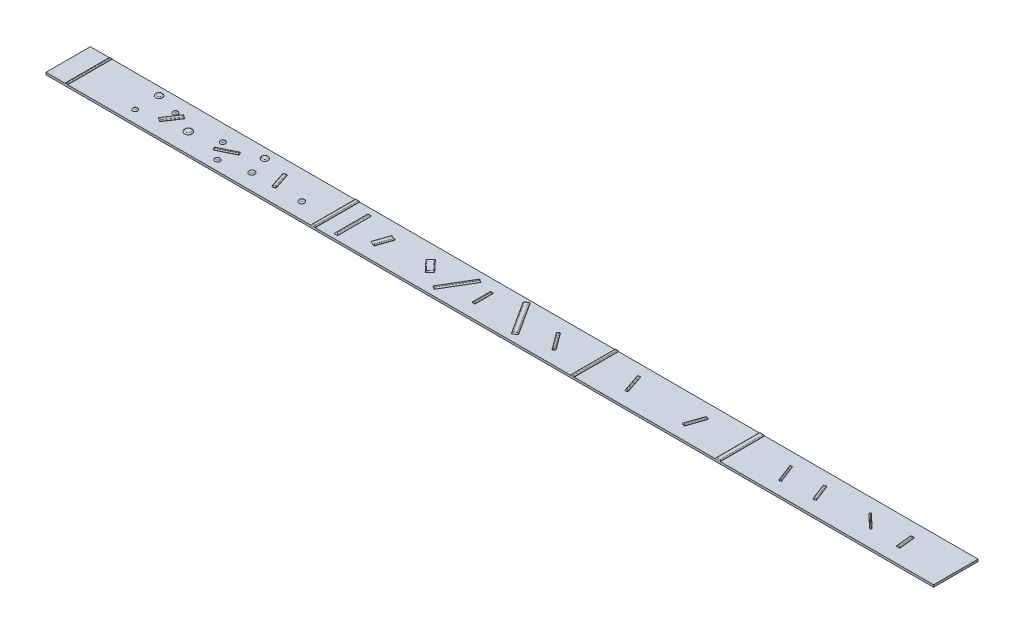
from build123d import *

# Parameters (mm, degrees)
CROQUIS1_W              = 40000
CROQUIS1_H              = 2000
SALIENTE_EXTRUIR1_DEPTH = 100
CROQUIS3_R              = 152.108396345
CROQUIS3_R_2            = 170.388191929
CROQUIS3_R_3            = 149.587088083
CROQUIS3_R_4            = 124.096570201
CROQUIS3_R_5            = 107.768052056
CROQUIS3_R_6            = 114.555528348
CROQUIS3_R_7            = 113.895307506
CROQUIS3_R_8            = 109.694025052
CROQUIS3_R_9            = 130.358105543
SALIENTE_EXTRUIR2_DEPTH = 50
REDONDEO1_R             = 50
CROQUIS4_W              = 143.310912253
CROQUIS4_H              = 1519.095669882
SALIENTE_EXTRUIR3_DEPTH = 50
REDONDEO2_R             = 50
CROQUIS2_W              = 100
CROQUIS2_H              = 2000
CROQUIS2_W_2            = 180.877173655
CROQUIS2_W_3            = 143.896077798
CROQUIS2_W_4            = 219.636697941
CROQUIS2_W_5            = 114.282510319
CROQUIS2_H_2            = 822.396549459
SALIENTE_EXTRUIR4_DEPTH = 50
REDONDEO3_R             = 40


with BuildPart() as part:
    # Croquis1 → Saliente-Extruir1 (new body)
    with BuildSketch(Plane(origin=(0, 0, 0), x_dir=(1, 0, 0), z_dir=(0, 1, 0))):
        Rectangle(CROQUIS1_W, CROQUIS1_H)
    extrude(amount=SALIENTE_EXTRUIR1_DEPTH)

    # Croquis3 → Saliente-Extruir2 (add)
    with BuildSketch(Plane(origin=(0, 100, 0), x_dir=(1, 0, 0), z_dir=(0, 1, 0))):
        with Locations(Location((-16527.746588557, 627.690739919, 0), (0, 0, 270))):
            Circle(CROQUIS3_R)
        with Locations(Location((-14473.623512929, -112.748973388, 0), (0, 0, 270))):
            Circle(CROQUIS3_R_2)
        with Locations(Location((-11694.98415869, 556.035283793, 0), (0, 0, 270))):
            Circle(CROQUIS3_R_3)
        with Locations(Location((-9187.043194261, -283.137165317, 0), (0, 0, 270))):
            Circle(CROQUIS3_R_4)
        with Locations(Location((-16527.746588557, -453.459030591, 0), (0, 0, 270))):
            Circle(CROQUIS3_R_5)
        with Locations(Location((-12713.049223627, -561.227082647, 0), (0, 0, 270))):
            Circle(CROQUIS3_R_6)
        with Locations(Location((-13274.85489442, 248.7980579, 0), (0, 0, 270))):
            Circle(CROQUIS3_R_7)
        with Locations(Location((-15488.636763855, 322.367848123, 0), (0, 0, 270))):
            Circle(CROQUIS3_R_8)
        with Locations(Location((-11435.610138848, -283.137165317, 0), (0, 0, 270))):
            Circle(CROQUIS3_R_9)
    extrude(amount=SALIENTE_EXTRUIR2_DEPTH)

    # Redondeo1
    redondeo1_edges = [part.edges().sort_by_distance(p)[0] for p in [
        (-16527.746588557, 150, -779.799136264),
        (-14473.623512929, 150, -57.639218541),
        (-11694.98415869, 150, -705.622371876),
        (-9187.043194261, 150, 159.040595117),
        (-16527.746588557, 150, 345.690978535),
        (-12713.049223627, 150, 446.6715543),
        (-13274.85489442, 150, -362.693365406),
        (-15488.636763855, 150, -432.061873176),
        (-11435.610138848, 150, 152.779059775),
    ]]
    fillet(redondeo1_edges, radius=REDONDEO1_R - 0.0001)  # a hair under: the kernel refuses the full size

    # Croquis4 → Saliente-Extruir3 (add)
    with BuildSketch(Plane(origin=(0, 100, 0), x_dir=(1, 0, 0), z_dir=(0, 1, 0))):
        Polygon((-2782.839723038, -722.088234936), (-1999.406736055, 596.372157792), (-2134.691169398, 676.758560213), (-2918.124156381, -641.701832515), align=None)
        with Locations((-7125.160364307, -48.526947347)):
            Rectangle(CROQUIS4_W, CROQUIS4_H)
        Polygon((-270.121728202, 768.345252496), (694.838414302, -722.088234936), (888.905049881, -596.442528568), (-76.055092623, 893.990958864), align=None)
    extrude(amount=SALIENTE_EXTRUIR3_DEPTH)

    # Redondeo2
    redondeo2_edges = [part.edges().sort_by_distance(p)[0] for p in [
        (406.424978629, 150, -148.774215148),
        (791.871732092, 150, 659.265381752),
        (212.35834305, 150, -23.12850878),
        (-173.088410412, 150, -831.16810568),
        (-2526.407662889, 150, -17.528363849),
        (-2067.048952726, 150, -636.565359002),
        (-2391.123229547, 150, 62.858038572),
        (-2850.48193971, 150, 681.895033726),
        (-7125.160364306, 150, -711.020887594),
        (-7053.50490818, 150, 48.526947347),
        (-7125.160364306, 150, 808.074782288),
        (-7196.815820433, 150, 48.526947347),
    ]]
    fillet(redondeo2_edges, radius=REDONDEO2_R - 0.0001)  # a hair under: the kernel refuses the full size

    # Croquis2 → Saliente-Extruir4 (add)
    with BuildSketch(Plane(origin=(0, 100, 0), x_dir=(1, 0, 0), z_dir=(0, 1, 0))):
        with Locations((-19073.938175418, 0)):
            Rectangle(CROQUIS2_W, CROQUIS2_H)
        Polygon((-13200.612317569, -266.885071318), (-12417.230490215, 116.812150244), (-12473.618644207, 231.937964643), (-13257.000471561, -151.759256918), align=None)
        with Locations((-7959.216706845, 0)):
            Rectangle(CROQUIS2_W_2, CROQUIS2_H)
        Polygon((-4111.603217322, 231.937964643), (-3644.070039938, -266.885071318), (-3424.528990466, -61.115255118), (-3892.06216785, 437.707780843), align=None)
        with Locations((3727.269343407, 0)):
            Rectangle(CROQUIS2_W_3, CROQUIS2_H)
        with Locations((10276.927676429, 0)):
            Rectangle(CROQUIS2_W_4, CROQUIS2_H)
        Polygon((-15509.781831253, -367.978873057), (-15663.991448235, -266.885071318), (-15215.863399016, 416.694472035), (-15061.653782035, 315.600670296), align=None)
        Polygon((-10543.603216778, 416.694472035), (-10693.38224704, 366.147571165), (-10439.279476977, -386.801983253), (-10289.500446715, -336.255082384), align=None)
        Polygon((-5806.725294453, 391.4210216), (-5586.272921152, 315.600670296), (-5827.123996956, -384.688768616), (-6047.576370257, -308.868417311), align=None)
        with Locations((-1346.297728627, 26.509506114)):
            Rectangle(CROQUIS2_W_5, CROQUIS2_H_2)
        Polygon((1682.872272567, 315.600670296), (1785.319109245, 391.4210216), (2334.724446597, -350.923716948), (2232.277609919, -426.744068252), align=None)
        Polygon((5296.79592742, 492.307284829), (5192.502339411, 457.110651194), (5476.323946606, -383.900852219), (5580.617534615, -348.704218584), align=None)
        Polygon((8191.434152086, -426.744068252), (8065.784994933, -383.900852219), (8340.18710195, 420.856508686), (8465.836259103, 378.013292653), align=None)
        Polygon((12135.083446709, 378.013292653), (12448.464036315, -426.744068252), (12535.667441119, -392.786187603), (12222.286851513, 411.971173302), align=None)
        Polygon((13771.056978067, 411.971173302), (14066.500580478, -346.724233045), (13948.056905032, -392.847388482), (13652.613302622, 365.848017865), align=None)
        Polygon((15767.342492683, 315.600670296), (16382.625284736, -266.885071318), (16437.643938463, -208.768574275), (15822.361146409, 373.717167338), align=None)
        Polygon((17597.961497728, 373.717167338), (17672.127380606, -346.724233045), (17811.07923868, -332.419825738), (17736.913355802, 388.021574645), align=None)
    extrude(amount=SALIENTE_EXTRUIR4_DEPTH)

    # Redondeo3
    redondeo3_edges = [part.edges().sort_by_distance(p)[0] for p in [
        (-19123.938175418, 150, 0),
        (-19073.938175418, 150, 1000),
        (-19023.938175418, 150, 0),
        (-19073.938175418, 150, -1000),
        (-8049.655293672, 150, 0),
        (-7959.216706845, 150, 1000),
        (-7868.778120017, 150, 0),
        (-7959.216706845, 150, -1000),
        (-15285.717806644, 150, 26.189101381),
        (-15138.758590525, 150, -366.147571165),
        (-15439.927423625, 150, -74.904700359),
        (-15586.886639744, 150, 317.431972187),
        (-13228.806394565, 150, 209.322164118),
        (-12808.921403892, 150, 75.036460537),
        (-12445.424567211, 150, -174.375057443),
        (-12865.309557884, 150, -40.089353862),
        (-10416.551831747, 150, -40.219694826),
        (-10618.492731909, 150, -391.4210216),
        (-10566.330862009, 150, 10.327206044),
        (-10364.389961846, 150, 361.528532818),
        (-5927.150832355, 150, -41.276302144),
        (-5937.350183606, 150, 346.778592964),
        (-5706.698459054, 150, 34.54404916),
        (-5696.499107803, 150, -353.510845948),
        (3655.321304508, 150, 0),
        (3727.269343407, 150, 1000),
        (3799.217382306, 150, 0),
        (3727.269343407, 150, -1000),
        (-1346.297728628, 150, -437.707780843),
        (-1403.438983787, 150, -26.509506114),
        (-1346.297728628, 150, 384.688768616),
        (-1289.156473468, 150, -26.509506114),
        (-4001.832692586, 150, -334.822872743),
        (-3877.83662863, 150, 17.473553337),
        (-3534.299515202, 150, 164.000163218),
        (-3658.295579158, 150, -188.296262863),
        (1957.574941243, 150, 55.571698978),
        (2283.501028258, 150, 388.8338926),
        (2060.021777921, 150, -20.248652326),
        (1734.095690906, 150, -353.510845948),
        (10167.109327458, 150, 0),
        (10276.927676428, 150, 1000),
        (10386.746025399, 150, 0),
        (10276.927676428, 150, -1000),
        (5438.706731018, 150, -71.801533123),
        (5244.649133415, 150, -474.708968011),
        (5334.413143009, 150, -36.604899487),
        (5528.470740611, 150, 366.302535401),
        (8328.635205594, 150, 24.3653878),
        (8403.011680526, 150, -399.434900669),
        (8202.986048442, 150, -18.477828233),
        (8128.609573509, 150, 405.322460236),
        (12178.685149111, 150, -394.992232977),
        (12291.773741512, 150, 24.3653878),
        (12492.065738717, 150, 409.765127928),
        (12378.977146316, 150, -9.59249285),
        (13711.835140344, 150, -388.909595584),
        (13800.335103827, 150, 13.499685308),
        (14007.278742755, 150, 369.785810763),
        (13918.778779272, 150, -32.623470129),
        (15794.851819546, 150, -344.658918817),
        (16074.98388871, 150, -24.357799489),
        (16410.134611599, 150, 237.826822796),
        (16130.002542436, 150, -82.474296532),
        (17667.437426765, 150, -380.869370991),
        (17635.044439167, 150, -13.496467147),
        (17741.603309643, 150, 339.572029392),
        (17773.996297241, 150, -27.800874453),
    ]]
    fillet(redondeo3_edges, radius=REDONDEO3_R)


solid = part.part
